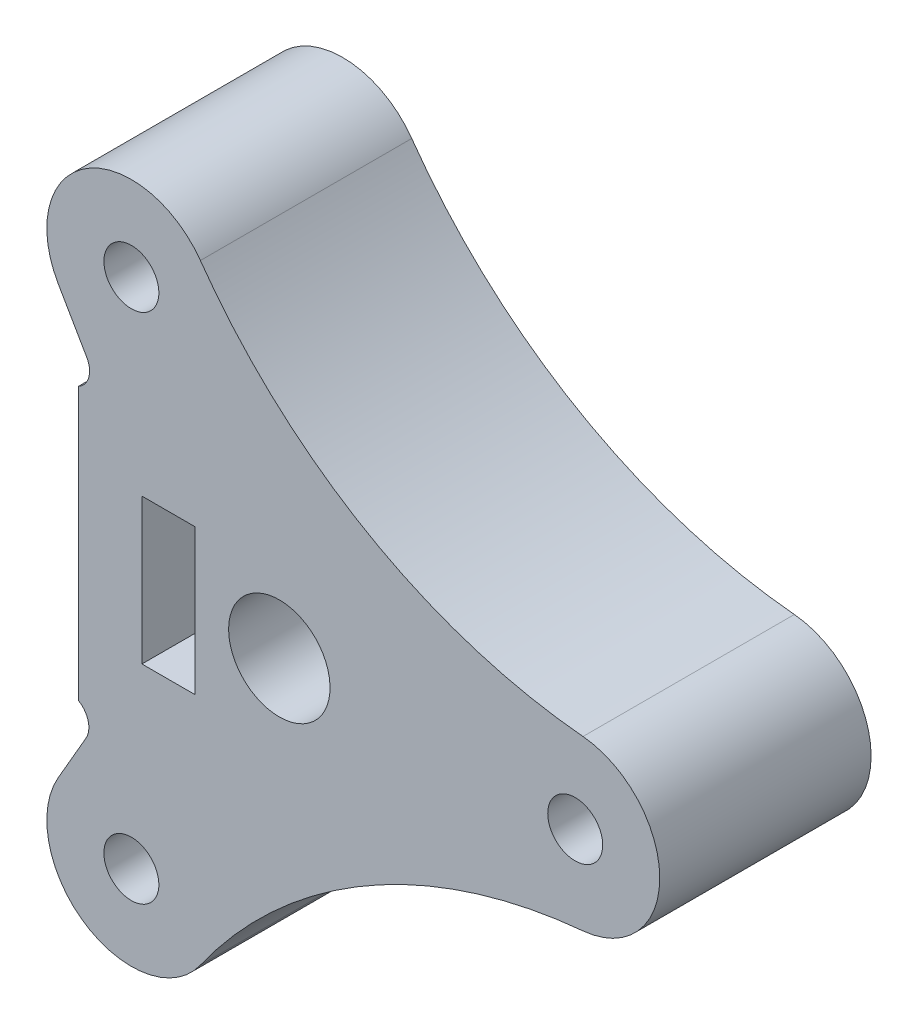
from build123d import *

# Parameters (mm, degrees)
SKETCH1_R               = 3.048
SKETCH1_W               = 3.175
SKETCH1_H               = 8.7376
BOSS_EXTRUDE1_DEPTH     = 17.78
SKETCH3_W               = 3.937
SKETCH3_H               = 8.7376
BOSS_EXTRUDE2_DEPTH     = 3.175
SKETCH5_R               = 1.651
SKETCH5_R_2             = 3.048
BOSS_EXTRUDE3_DEPTH     = 17.78
FILLET1_R               = 31.75
FILLET2_R               = 1.27
SKETCH2_R               = 2.159
CUT_EXTRUDE2_DEPTH      = 12.7
CUT_EXTRUDE3_DEPTH      = 45.217979663
CUT_EXTRUDE3_DEPTH_BACK = 45.217979663
SKETCH7_W               = 24.098797772
SKETCH7_H               = 63.864925988
SKETCH7_W_2             = 12.7
SKETCH7_H_2             = 50.8


with BuildPart() as part:
    # Sketch1 → Boss-Extrude1 (new body)
    with BuildSketch(Plane.XY):
        with BuildLine():
            Line((-12.065, 8.128), (-1.27, 8.128))
            Line((-1.27, 8.128), (3.448633975, 4.557208434))
            ThreePointArc((3.448633975, 4.557208434), (5.712149959, 0.180465622), (3.72942373, -4.33042996))
            Line((3.72942373, -4.33042996), (-1.27, -8.2296))
            Line((-1.27, -8.2296), (-12.065, -8.2296))
            Line((-12.065, -8.2296), (-12.065, 8.128))
        make_face()
        Circle(SKETCH1_R, mode=Mode.SUBTRACT)
        with Locations((-6.6675, -0.0508)):
            Rectangle(SKETCH1_W, SKETCH1_H, mode=Mode.SUBTRACT)
    extrude(amount=BOSS_EXTRUDE1_DEPTH)

    # Sketch3 → Boss-Extrude2 (add)
    with BuildSketch(Plane.ZY.offset(5.08)):
        with Locations((1.9685, -0.0508)):
            Rectangle(SKETCH3_W, SKETCH3_H)
    extrude(amount=BOSS_EXTRUDE2_DEPTH)

    # Sketch5 → Boss-Extrude3 (add)
    with BuildSketch(Plane(origin=(0, 0, 0), x_dir=(-1, 0, 0), z_dir=(0, 0, -1))):
        with BuildLine():
            Line((-2.932939367, 5.08), (4.490590949, 17.937931679))
            ThreePointArc((4.490590949, 17.937931679), (11.43, 19.797340731), (13.289409051, 12.857931679))
            Line((13.289409051, 12.857931679), (8.652171134, 4.826))
            Line((8.652171134, 4.826), (5.08, 4.826))
            Line((5.08, 4.826), (5.08, -4.4196))
            Line((5.08, -4.4196), (8.417535985, -4.4196))
            Line((8.417535985, -4.4196), (13.289409051, -12.857931679))
            ThreePointArc((13.289409051, -12.857931679), (11.43, -19.797340731), (4.490590949, -17.937931679))
            Line((4.490590949, -17.937931679), (-2.932939367, -5.08))
            Line((-2.932939367, -5.08), (-17.78, -5.08))
            ThreePointArc((-17.78, -5.08), (-22.86, 0), (-17.78, 5.08))
            Line((-17.78, 5.08), (-2.932939367, 5.08))
        make_face()
        with Locations((8.89, 15.397931679)):
            Circle(SKETCH5_R, mode=Mode.SUBTRACT)
        with Locations((8.89, -15.397931679)):
            Circle(SKETCH5_R, mode=Mode.SUBTRACT)
        with Locations((-17.78, 0)):
            Circle(SKETCH5_R, mode=Mode.SUBTRACT)
        with Locations(Location((0, 0, 0), (0, 0, 180))):
            Circle(SKETCH5_R_2, mode=Mode.SUBTRACT)
    extrude(amount=-BOSS_EXTRUDE3_DEPTH)

    # Fillet1
    fillet1_edges = [part.edges().sort_by_distance(p)[0] for p in [
        (2.932939367, -5.08, 8.89),
        (2.932939367, 5.08, 8.89),
    ]]
    fillet(fillet1_edges, radius=FILLET1_R)

    # Fillet2
    # the kernel refuses this fillet: 1.27 mm, written as the material it adds along each edge
    with BuildSketch(Plane(origin=(-10.558581723, 8.128, 17.78), x_dir=(-0.4999999999999911, 0.8660254037844438, 0), z_dir=(0, 0, -1))) as fillet2_piece_1:
        with BuildLine():
            CenterArc((2.022737824, -1.27), FILLET2_R, 90, 91.561006687)
            Line((0.753209139, -1.304596497), (0.727818565, -1.305288427))
            ThreePointArc((0.727818565, -1.305288427), (0.354607524, -0.664998248), (-0.021997045, -0.0127))
            Line((-0.021997045, -0.0127), (0, 0.0254))
            Line((0, 0.0254), (2.022737824, 0.0254))
            Line((2.022737824, 0.0254), (2.022737824, 0))
        make_face()
    extrude(amount=17.78)
    with BuildSketch(Plane(origin=(-10.61724051, -8.2296, 0), x_dir=(-1, 0, 0), z_dir=(0, 0, 1))) as fillet2_piece_2:
        with BuildLine():
            CenterArc((2.096740449, 1.091660989), FILLET2_R, 150, 89.268962563)
            Line((0.996888187, 1.726660989), (0.974891141, 1.739360989))
            Line((0.974891141, 1.739360989), (-0.021997045, 0.0127))
            Line((-0.021997045, 0.0127), (0, -0.0254))
            ThreePointArc((0, -0.0254), (0.723879745, -0.0254), (1.434779871, -0.02183322))
            Line((1.434779871, -0.02183322), (1.44775949, 0))
        make_face()
    extrude(amount=17.78)

    # Sketch2 → Cut-Extrude2 (cut)
    with BuildSketch(Plane.ZY.offset(12.065)):
        with Locations(Location((8.89, -0.0508, 0), (0, 0, 270))):
            Circle(SKETCH2_R)
    extrude(amount=-CUT_EXTRUDE2_DEPTH, mode=Mode.SUBTRACT)

    # Sketch7 → Cut-Extrude3 (cut, two sides: drawn at the far end of the back side and taken through both)
    with BuildSketch(Plane.ZY.offset(12.065).offset(-CUT_EXTRUDE3_DEPTH_BACK)):
        with Locations((8.89, -0.0508)):
            Rectangle(SKETCH7_W, SKETCH7_H)
        with Locations((8.89, -0.0508)):
            Rectangle(SKETCH7_W_2, SKETCH7_H_2, mode=Mode.SUBTRACT)
    extrude(amount=CUT_EXTRUDE3_DEPTH + CUT_EXTRUDE3_DEPTH_BACK, mode=Mode.SUBTRACT)


solid = part.part
